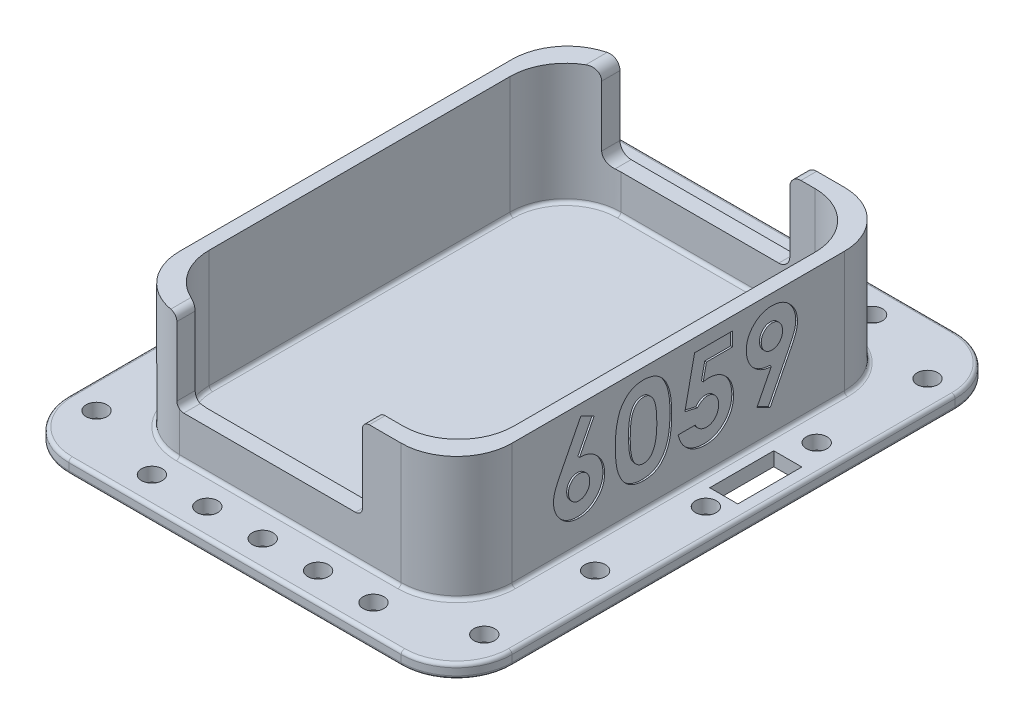
from build123d import *

# Parameters (mm, degrees)
SKETCH1_W                      = 76.2
SKETCH1_H                      = 101.6
BOSS_EXTRUDE1_DEPTH            = 0.79375
SKETCH2_W                      = 76.2
SKETCH2_H                      = 101.6
SKETCH2_W_2                    = 69.85
SKETCH2_H_2                    = 94.361
BOSS_EXTRUDE2_DEPTH            = 27.178
FILLET1_R                      = 12.7
SKETCH3_W                      = 42.545
SKETCH3_H                      = 18.44675
CUT_EXTRUDE1_DEPTH             = 113.056185898
BOSS_EXTRUDE3_START            = 0.508
BOSS_EXTRUDE3_DEPTH            = 0.508
FILLET2_R                      = 1.5875
SKETCH5_W                      = 101.6
SKETCH5_H                      = 127
BOSS_EXTRUDE4_DEPTH            = 3.175
FILLET3_R                      = 12.7
F_3_16_0_1875_DIAMETER_HOLE1_D = 4.7625
FILLET4_R                      = 0.79375
FILLET5_R                      = 0.79375
CUT_EXTRUDE2_DEPTH             = 0.396875
CUT_EXTRUDE3_DEPTH             = 0.396875
FILLET7_R                      = 0.79375
SKETCH11_W                     = 6.442740225
SKETCH11_H                     = 14.683454467
CUT_EXTRUDE4_DEPTH             = 25.4
FILLET8_R                      = 2.54


with BuildPart() as part:
    # Sketch1 → Boss-Extrude1 (new body)
    with BuildSketch(Plane(origin=(0, 0, 0), x_dir=(1, 0, 0), z_dir=(0, 1, 0))):
        Rectangle(SKETCH1_W, SKETCH1_H)
    extrude(amount=BOSS_EXTRUDE1_DEPTH)

    # Sketch2 → Boss-Extrude2 (add)
    with BuildSketch(Plane(origin=(0, 0.79375, 0), x_dir=(1, 0, 0), z_dir=(0, 1, 0))):
        Rectangle(SKETCH2_W, SKETCH2_H)
        Rectangle(SKETCH2_W_2, SKETCH2_H_2, mode=Mode.SUBTRACT)
    extrude(amount=BOSS_EXTRUDE2_DEPTH)

    # Fillet1
    fillet1_edges = [part.edges().sort_by_distance(p)[0] for p in [
        (38.1, 13.985875, 50.8),
        (-38.1, 13.985875, 50.8),
        (-38.1, 13.985875, -50.8),
        (38.1, 13.985875, -50.8),
        (34.925, 14.38275, 47.1805),
        (-34.925, 14.38275, 47.1805),
        (34.925, 14.38275, -47.1805),
        (-34.925, 14.38275, -47.1805),
    ]]
    fillet(fillet1_edges, radius=FILLET1_R)

    # Sketch3 → Cut-Extrude1 (cut, through all)
    with BuildSketch(Plane.XY.offset(50.8)):
        with Locations((-4.7625, 18.748375)):
            Rectangle(SKETCH3_W, SKETCH3_H)
    extrude(amount=-CUT_EXTRUDE1_DEPTH, mode=Mode.SUBTRACT)

    # Sketch4 → Boss-Extrude3 (add)
    with BuildSketch(Plane(origin=(0, 27.97175, 0), x_dir=(1, 0, 0), z_dir=(0, 1, 0)).offset(BOSS_EXTRUDE3_START)):
        with BuildLine():
            Line((16.51, -47.1805), (16.51, -50.8))
            Line((16.51, -50.8), (25.4, -50.8))
            ThreePointArc((25.4, -50.8), (34.380256121, -47.080256121), (38.1, -38.1))
            Line((38.1, -38.1), (38.1, 38.1))
            ThreePointArc((38.1, 38.1), (34.380256121, 47.080256121), (25.4, 50.8))
            Line((25.4, 50.8), (16.51, 50.8))
            Line((16.51, 50.8), (16.51, 47.1805))
            Line((16.51, 47.1805), (22.225, 47.1805))
            ThreePointArc((22.225, 47.1805), (31.205256121, 43.460756121), (34.925, 34.4805))
            Line((34.925, 34.4805), (34.925, -34.4805))
            ThreePointArc((34.925, -34.4805), (31.205256121, -43.460756121), (22.225, -47.1805))
            Line((22.225, -47.1805), (16.51, -47.1805))
        make_face()
        with BuildLine():
            ThreePointArc((-38.1, -38.1), (-34.602024234, -46.852870958), (-26.035, -50.784115066))
            Line((-26.035, -50.784115066), (-26.035, -46.595527858))
            ThreePointArc((-26.035, -46.595527858), (-32.46406734, -41.993921325), (-34.925, -34.4805))
            Line((-34.925, -34.4805), (-34.925, 34.4805))
            ThreePointArc((-34.925, 34.4805), (-32.46406734, 41.993921325), (-26.035, 46.595527858))
            Line((-26.035, 46.595527858), (-26.035, 50.784115066))
            ThreePointArc((-26.035, 50.784115066), (-34.602024234, 46.852870958), (-38.1, 38.1))
            Line((-38.1, 38.1), (-38.1, -38.1))
        make_face()
    extrude(amount=-BOSS_EXTRUDE3_DEPTH)

    # Fillet2
    fillet2_edges = [part.edges().sort_by_distance(p)[0] for p in [
        (16.51, 28.47975, 48.99025),
        (16.51, 9.525, 48.99025),
        (-26.035, 9.525, 48.689821462),
        (-26.035, 28.47975, 48.689821462),
    ]]
    fillet(fillet2_edges, radius=FILLET2_R)

    # Sketch5 → Boss-Extrude4 (add)
    with BuildSketch(Plane.XZ):
        Rectangle(SKETCH5_W, SKETCH5_H)
    extrude(amount=BOSS_EXTRUDE4_DEPTH)

    # Fillet3
    fillet3_edges = [part.edges().sort_by_distance(p)[0] for p in [
        (-50.8, -1.5875, -63.5),
        (50.8, -1.5875, -63.5),
        (50.8, -1.5875, 63.5),
        (-50.8, -1.5875, 63.5),
    ]]
    fillet(fillet3_edges, radius=FILLET3_R)

    # 3/16 (0.1875) Diameter Hole1 (through all)
    with Locations(Plane(origin=(-44.45, 0, 50.8), x_dir=(0, 0, 1), z_dir=(0, 1, 0))):
        with Locations((0, 0), (-25.4, 0), (-50.8, 0), (-76.2, 0), (-101.6, 0), (6.35, 19.05), (6.35, 31.75), (6.35, 44.45), (6.35, 57.15), (6.35, 69.85), (0, 88.9), (-25.4, 88.9), (-50.8, 88.9), (-76.2, 88.9), (-101.6, 88.9), (-107.95, 69.85), (-107.95, 57.15), (-107.95, 44.45), (-107.95, 31.75), (-107.95, 19.05)):
            Hole(F_3_16_0_1875_DIAMETER_HOLE1_D / 2)

    # Fillet4
    fillet4_edges = [part.edges().sort_by_distance(p)[0] for p in [
        (-34.380256121, 0, -47.080256121),
        (0, 0, -50.8),
        (34.380256121, 0, -47.080256121),
        (38.1, 0, 0),
        (34.380256121, 0, 47.080256121),
        (0, 0, 50.8),
        (-34.380256121, 0, 47.080256121),
        (-38.1, 0, 0),
    ]]
    fillet(fillet4_edges, radius=FILLET4_R)

    # Fillet5
    fillet5_edges = [part.edges().sort_by_distance(p)[0] for p in [
        (47.080256121, -3.175, 59.780256121),
        (50.8, -3.175, 0),
        (47.080256121, -3.175, -59.780256121),
        (0, -3.175, -63.5),
        (-47.080256121, -3.175, -59.780256121),
        (-50.8, -3.175, 0),
        (-47.080256121, -3.175, 59.780256121),
        (47.080256121, 0, 59.780256121),
        (50.8, 0, 0),
        (47.080256121, 0, -59.780256121),
        (0, 0, -63.5),
        (-47.080256121, 0, -59.780256121),
        (-50.8, 0, 0),
        (-47.080256121, 0, 59.780256121),
        (0, -3.175, 63.5),
        (0, 0, 63.5),
    ]]
    fillet(fillet5_edges, radius=FILLET5_R)

    # Sketch9 → Cut-Extrude2 (cut)
    # profile 1 of 4: a face of its own
    with BuildSketch(Plane.ZY.offset(38.1)):
        with BuildLine():
            Line((-21.67815406, 26.514268643), (-18.651982185, 24.980194124))
            Line((-18.651982185, 24.980194124), (-21.971994204, 18.454653258))
            add(Edge.make_bspline(
                [(-21.971994204, 18.454653258), (-21.775851009, 18.449575012), (-21.389514821, 18.439572574), (-20.821099511, 18.358731191), (-20.277683894, 18.218975825), (-19.753788733, 18.033730465), (-19.255818152, 17.784944107), (-18.775752056, 17.488999756), (-18.326009998, 17.128063787), (-17.896279778, 16.728165883), (-17.505528296, 16.285136477), (-17.166091552, 15.809087307), (-16.870278422, 15.311600707), (-16.640325199, 14.781546695), (-16.454837273, 14.22771152), (-16.320999571, 13.647881262), (-16.244641417, 13.040376863), (-16.234114172, 12.627671605), (-16.228755021, 12.417573932)],
                knots=[0, 0, 0, 0, 1.013260694, 1.995783107, 2.958651975, 3.908806537, 4.861209129, 5.829647963, 6.817170299, 7.835534541, 8.860094905, 9.863329007, 10.853101798, 11.844815043, 12.84250023, 13.867713965, 14.914507806, 16, 16, 16, 16], degree=3))
            add(Edge.make_bspline(
                [(-16.228755021, 12.417573932), (-16.233776989, 12.215052519), (-16.243703266, 11.81475453), (-16.325757085, 11.226818591), (-16.458360367, 10.662728441), (-16.647877085, 10.123610637), (-16.888768161, 9.606829956), (-17.183361629, 9.11268965), (-17.534100571, 8.644882268), (-17.931922863, 8.205893512), (-18.366811257, 7.805752016), (-18.82520731, 7.450082966), (-19.310995415, 7.156286837), (-19.814993607, 6.908169119), (-20.346480801, 6.723019551), (-20.897503265, 6.583263701), (-21.472239563, 6.502618509), (-21.862355836, 6.492477285), (-22.059764637, 6.487345566)],
                knots=[0, 0, 0, 0, 1.049934834, 2.075270938, 3.072134561, 4.05064612, 5.033440221, 6.024524368, 7.028587226, 8.060776465, 9.092543989, 10.090062252, 11.064205434, 12.031961459, 12.998029633, 13.977230324, 14.976426867, 16, 16, 16, 16], degree=3))
            add(Edge.make_bspline(
                [(-22.059764637, 6.487345566), (-22.266194253, 6.491556895), (-22.672110161, 6.499837904), (-23.266066723, 6.592563379), (-23.835722186, 6.732148656), (-24.377874992, 6.931452715), (-24.895896629, 7.185228629), (-25.383688327, 7.499250799), (-25.845359054, 7.8700564), (-26.275986725, 8.289302893), (-26.663950165, 8.748530063), (-27.009981128, 9.225327428), (-27.30272377, 9.720443189), (-27.539692114, 10.233347973), (-27.724580312, 10.762407385), (-27.853224789, 11.308625538), (-27.937048537, 11.870553587), (-27.94687496, 12.25190976), (-27.951831945, 12.444286672)],
                knots=[0, 0, 0, 0, 1.063775006, 2.091769615, 3.092589432, 4.084662827, 5.064601646, 6.061867366, 7.070035304, 8.113879863, 9.156342271, 10.166834137, 11.149076039, 12.117706134, 13.076241869, 14.034148791, 15.008317125, 16, 16, 16, 16], degree=3))
            add(Edge.make_bspline(
                [(-27.951831945, 12.444286672), (-27.949212771, 12.593260086), (-27.943959845, 12.892036161), (-27.891171076, 13.339437097), (-27.810913605, 13.788012419), (-27.717884687, 14.166534479), (-27.622092907, 14.486614495), (-27.525677744, 14.757489563), (-27.406192394, 15.058101659), (-27.269602939, 15.389218425), (-27.111614139, 15.750441528), (-26.933051298, 16.140786368), (-26.733469876, 16.563208929), (-26.591140833, 16.853347819), (-26.516976175, 17.004533066)],
                knots=[0, 0, 0, 0, 1.110454016, 2.227089276, 3.35462975, 4.507227546, 5.131400587, 5.845402449, 6.650387134, 7.543487832, 8.516250726, 9.590168902, 10.744287919, 12, 12, 12, 12], degree=3))
            Line((-26.516976175, 17.004533066), (-21.67815406, 26.514268643))
        make_face()
        with BuildLine():
            add(Edge.make_bspline(
                [(-22.136086752, 15.279653258), (-22.300151851, 15.272127939), (-22.621205714, 15.257401877), (-23.077696292, 15.103183383), (-23.493912129, 14.86125295), (-23.854693164, 14.524318033), (-24.156453303, 14.121667577), (-24.37819724, 13.662390949), (-24.511588543, 13.152617068), (-24.525447045, 12.79619167), (-24.532601175, 12.612195326)],
                knots=[0, 0, 0, 0, 0.981744412, 1.921144944, 2.858899012, 3.85339082, 4.86292663, 5.863643845, 6.897155691, 8, 8, 8, 8], degree=3))
            add(Edge.make_bspline(
                [(-24.532601175, 12.612195326), (-24.524130461, 12.42813771), (-24.507654356, 12.070133345), (-24.369247366, 11.555505507), (-24.142632178, 11.085799239), (-23.824818827, 10.67781279), (-23.451710521, 10.33915245), (-23.037977664, 10.088696935), (-22.590521469, 9.934833894), (-22.281005091, 9.916060561), (-22.124638435, 9.906576335)],
                knots=[0, 0, 0, 0, 1.098279937, 2.136227893, 3.159405121, 4.194678092, 5.206500211, 6.154139736, 7.067477469, 8, 8, 8, 8], degree=3))
            add(Edge.make_bspline(
                [(-22.124638435, 9.906576335), (-21.959497573, 9.916229482), (-21.635627661, 9.935160979), (-21.168424071, 10.082549745), (-20.741630789, 10.328809309), (-20.364262972, 10.666385399), (-20.040111188, 11.069716174), (-19.815830896, 11.542181431), (-19.671025289, 12.060523669), (-19.655837812, 12.4241818), (-19.647985791, 12.612195326)],
                knots=[0, 0, 0, 0, 0.96921794, 1.900804717, 2.848419905, 3.844199796, 4.861108892, 5.867439427, 6.897452859, 8, 8, 8, 8], degree=3))
            add(Edge.make_bspline(
                [(-19.647985791, 12.612195326), (-19.656930677, 12.796084237), (-19.674253493, 13.152206585), (-19.804368371, 13.664368639), (-20.0366797, 14.121875045), (-20.345267406, 14.525980111), (-20.718464609, 14.862764787), (-21.151338252, 15.105091322), (-21.628682081, 15.257128652), (-21.964485864, 15.272035586), (-22.136086752, 15.279653258)],
                knots=[0, 0, 0, 0, 1.083229974, 2.097801324, 3.086792542, 4.086858909, 5.079819718, 6.026392613, 6.991456328, 8, 8, 8, 8], degree=3))
        make_face(mode=Mode.SUBTRACT)
    # profile 2 of 4: a face of its own
    with BuildSketch(Plane.ZY.offset(38.1)):
        with BuildLine():
            add(Edge.make_bspline(
                [(-7.371573531, 26.514268643), (-7.20606857, 26.511811675), (-6.880641598, 26.50698062), (-6.401348924, 26.454656358), (-5.939657563, 26.375608991), (-5.493761321, 26.265365478), (-5.066869805, 26.119462115), (-4.655876008, 25.944818291), (-4.265671948, 25.732273577), (-3.891281276, 25.492193407), (-3.532848207, 25.22038862), (-3.198987429, 24.910517128), (-2.883601935, 24.569709088), (-2.59351866, 24.192812094), (-2.322313621, 23.783254422), (-2.070877952, 23.340971131), (-1.841136456, 22.86379754), (-1.630514278, 22.350872552), (-1.442175262, 21.794507641), (-1.283537542, 21.188321061), (-1.147479152, 20.53217438), (-1.032636271, 19.824434349), (-0.945833615, 19.064160211), (-0.887326877, 18.251857056), (-0.847176784, 17.389090884), (-0.843900014, 16.797240379), (-0.84221656, 16.493174893)],
                knots=[0, 0, 0, 0, 0.879237366, 1.728815576, 2.559023295, 3.367336655, 4.166867292, 4.954216142, 5.737608147, 6.525189134, 7.316157332, 8.124696809, 8.942788509, 9.781158001, 10.649253743, 11.551476218, 12.482711956, 13.461909668, 14.496590415, 15.601789533, 16.789733467, 18.056700938, 19.410929216, 20.8549011, 22.384193279, 24, 24, 24, 24], degree=3))
            add(Edge.make_bspline(
                [(-0.84221656, 16.493174893), (-0.844035918, 16.185305206), (-0.847570899, 15.587119928), (-0.885657826, 14.716462458), (-0.951245313, 13.898261494), (-1.035779201, 13.132601685), (-1.151567503, 12.419887362), (-1.2871717, 11.758273076), (-1.448313468, 11.147998645), (-1.642856311, 10.590439148), (-1.852203588, 10.07661335), (-2.082573526, 9.600370134), (-2.329950809, 9.160419569), (-2.588661349, 8.750124403), (-2.872888608, 8.381579928), (-3.168798445, 8.042253705), (-3.489275303, 7.745071106), (-3.820825866, 7.474716672), (-4.175596174, 7.241076187), (-4.549927572, 7.03673807), (-4.950493741, 6.870995589), (-5.369993039, 6.726841631), (-5.815575919, 6.623354643), (-6.280162128, 6.541241119), (-6.768996751, 6.495860149), (-7.101815052, 6.490230341), (-7.272354781, 6.487345566)],
                knots=[0, 0, 0, 0, 1.643780988, 3.193836972, 4.651895693, 6.025988579, 7.305620092, 8.505800249, 9.631074763, 10.672816429, 11.65661981, 12.592235626, 13.49536222, 14.350718032, 15.179365177, 15.97804903, 16.751647189, 17.51006938, 18.259804725, 19.016521909, 19.783502495, 20.571750527, 21.382245291, 22.22305063, 23.089471752, 24, 24, 24, 24], degree=3))
            add(Edge.make_bspline(
                [(-7.272354781, 6.487345566), (-7.442889907, 6.490285987), (-7.776965711, 6.496046227), (-8.267122192, 6.540903692), (-8.734170475, 6.623687286), (-9.183278631, 6.727636127), (-9.611320938, 6.870676634), (-10.020349846, 7.041378012), (-10.407220277, 7.24444116), (-10.773003415, 7.478626006), (-11.116450371, 7.747171564), (-11.442898309, 8.047205437), (-11.751625108, 8.377967119), (-12.037934266, 8.743161412), (-12.306514701, 9.137913735), (-12.554565542, 9.566731968), (-12.781937718, 10.028991761), (-12.995743472, 10.525337456), (-13.181513608, 11.066454808), (-13.346840404, 11.657175926), (-13.482271766, 12.302424957), (-13.59119473, 13.001994609), (-13.678158762, 13.754402812), (-13.742850006, 14.560012733), (-13.781148489, 15.419199604), (-13.784646398, 16.009761539), (-13.786447329, 16.313817922)],
                knots=[0, 0, 0, 0, 0.917216111, 1.796812873, 2.643793957, 3.46689424, 4.273913431, 5.068098542, 5.848489301, 6.620921603, 7.401012384, 8.190319798, 9.003608147, 9.831726257, 10.68377682, 11.569763213, 12.493818149, 13.453288342, 14.474581811, 15.568529029, 16.750744269, 18.018426408, 19.375425659, 20.823733699, 22.36466933, 24, 24, 24, 24], degree=3))
            add(Edge.make_bspline(
                [(-13.786447329, 16.313817922), (-13.78318511, 16.73628033), (-13.776890616, 17.551426989), (-13.697122168, 18.729076907), (-13.580042319, 19.817610258), (-13.408079753, 20.815206193), (-13.195450419, 21.725559517), (-12.923167485, 22.542673299), (-12.613193171, 23.27785414), (-12.349055233, 23.713379697), (-12.221843964, 23.923132826)],
                knots=[0, 0, 0, 0, 1.288568992, 2.486310467, 3.599230591, 4.627010532, 5.572937695, 6.447898582, 7.252493626, 8, 8, 8, 8], degree=3))
            add(Edge.make_bspline(
                [(-12.221843964, 23.923132826), (-12.073928759, 24.129194234), (-11.784725386, 24.532084893), (-11.279045206, 25.061005017), (-10.73575769, 25.513363407), (-10.143704024, 25.878922788), (-9.512247783, 26.167202945), (-8.835967593, 26.370811974), (-8.117360844, 26.489444081), (-7.623881603, 26.50587022), (-7.371573531, 26.514268643)],
                knots=[0, 0, 0, 0, 1.058512271, 2.069600068, 3.047294572, 4.004278952, 4.967380941, 5.939006123, 6.946246673, 8, 8, 8, 8], degree=3))
        make_face()
        with BuildLine():
            add(Edge.make_bspline(
                [(-7.287619204, 23.095037874), (-7.437237061, 23.087946285), (-7.730567483, 23.074043006), (-8.1562039, 22.956023785), (-8.557552467, 22.773736734), (-8.862847602, 22.554382769), (-9.091357974, 22.344105688), (-9.25101981, 22.153811768), (-9.404988486, 21.941457469), (-9.540981374, 21.697460331), (-9.66939416, 21.430587462), (-9.794892158, 21.139627417), (-9.897767563, 20.817433588), (-9.99883992, 20.469492979), (-10.087388736, 20.086185955), (-10.161573232, 19.664379405), (-10.227850558, 19.201330282), (-10.274079783, 18.696735287), (-10.317179294, 18.151122352), (-10.348075065, 17.563276063), (-10.360991811, 16.933355009), (-10.365097651, 16.499537726), (-10.36721656, 16.275656864)],
                knots=[0, 0, 0, 0, 1.076674018, 2.110852608, 3.161083442, 4.239746716, 4.804137807, 5.395870207, 6.026861976, 6.692161227, 7.405688833, 8.16177676, 8.973626916, 9.841385931, 10.773283133, 11.807421078, 12.927755683, 14.143907515, 15.458935494, 16.872852025, 18.386167141, 20, 20, 20, 20], degree=3))
            add(Edge.make_bspline(
                [(-10.36721656, 16.275656864), (-10.363729094, 15.985608384), (-10.357041618, 15.429418919), (-10.322015749, 14.629599101), (-10.2518093, 13.901698664), (-10.164486653, 13.240784356), (-10.041838429, 12.651142384), (-9.900723708, 12.127194187), (-9.726459575, 11.675618833), (-9.525063792, 11.289885528), (-9.302008888, 10.961743006), (-9.059872977, 10.682820384), (-8.806899919, 10.441286553), (-8.535193604, 10.245091599), (-8.24540224, 10.09473683), (-7.939945054, 9.986588501), (-7.61862793, 9.920386406), (-7.398593276, 9.911206303), (-7.287619204, 9.906576335)],
                knots=[0, 0, 0, 0, 1.771748488, 3.397459088, 4.888034009, 6.237357457, 7.467047327, 8.564189669, 9.548206622, 10.417051504, 11.216568818, 11.965764335, 12.669334354, 13.348544111, 14.005342236, 14.656555988, 15.322436492, 16, 16, 16, 16], degree=3))
            add(Edge.make_bspline(
                [(-7.287619204, 9.906576335), (-7.180453411, 9.909744503), (-6.970636113, 9.915947382), (-6.664675502, 9.979619099), (-6.375337408, 10.083135482), (-6.103495433, 10.229566673), (-5.848177236, 10.415776336), (-5.610630654, 10.642582757), (-5.392647217, 10.912246667), (-5.265649076, 11.112377169), (-5.200209348, 11.215500614)],
                knots=[0, 0, 0, 0, 0.992283464, 1.942767638, 2.88273346, 3.832339453, 4.79467288, 5.803907806, 6.868395428, 8, 8, 8, 8], degree=3))
            add(Edge.make_bspline(
                [(-5.200209348, 11.215500614), (-5.12316509, 11.356415506), (-4.961609528, 11.651902605), (-4.774657152, 12.150526068), (-4.617291062, 12.712890922), (-4.48184837, 13.340747302), (-4.389213831, 14.03657155), (-4.309437079, 14.795951384), (-4.270958769, 15.622710733), (-4.264700062, 16.195492593), (-4.261447329, 16.493174893)],
                knots=[0, 0, 0, 0, 0.710965849, 1.490837728, 2.352621235, 3.297892224, 4.334225155, 5.461620853, 6.680770821, 8, 8, 8, 8], degree=3))
            add(Edge.make_bspline(
                [(-4.261447329, 16.493174893), (-4.26270379, 16.793441219), (-4.265122261, 17.371402639), (-4.309494212, 18.201134246), (-4.371285544, 18.958956364), (-4.461668425, 19.643177082), (-4.577962429, 20.25545739), (-4.721295227, 20.795757262), (-4.890273935, 21.265141525), (-5.090662544, 21.663142139), (-5.312605379, 22.001388063), (-5.548204474, 22.29157683), (-5.798456037, 22.539332678), (-6.062941567, 22.745587956), (-6.347782673, 22.903182457), (-6.647538519, 23.014457212), (-6.962823627, 23.081774707), (-7.177892706, 23.090557145), (-7.287619204, 23.095037874)],
                knots=[0, 0, 0, 0, 1.793836731, 3.452829483, 4.963243077, 6.335886805, 7.574563692, 8.684454726, 9.672768357, 10.54971625, 11.340229787, 12.085688095, 12.778991901, 13.440269426, 14.083255152, 14.715733572, 15.344777694, 16, 16, 16, 16], degree=3))
        make_face(mode=Mode.SUBTRACT)
    # profile 3 of 4: a face of its own
    with BuildSketch(Plane.ZY.offset(38.1)):
        with BuildLine():
            Line((4.404928873, 26.025807105), (13.078937286, 26.025807105))
            Line((13.078937286, 26.025807105), (13.078937286, 22.850807105))
            Line((13.078937286, 22.850807105), (7.114363969, 22.850807105))
            Line((7.114363969, 22.850807105), (6.370223344, 19.248403258))
            add(Edge.make_bspline(
                [(6.370223344, 19.248403258), (6.471623156, 19.276644386), (6.67160442, 19.332341693), (6.972876441, 19.388199044), (7.264851015, 19.424404004), (7.456442949, 19.429233263), (7.549400027, 19.431576335)],
                knots=[0, 0, 0, 0, 1.05461699, 2.079921384, 3.068411212, 4, 4, 4, 4], degree=3))
            add(Edge.make_bspline(
                [(7.549400027, 19.431576335), (7.751963237, 19.426934717), (8.151259947, 19.417785064), (8.735380365, 19.330925016), (9.294710172, 19.194123071), (9.827537757, 18.999015274), (10.333342618, 18.745077436), (10.812737891, 18.437883836), (11.266311953, 18.076894931), (11.686007419, 17.661884711), (12.071641145, 17.206194092), (12.406927675, 16.713316471), (12.693283295, 16.190279802), (12.921040655, 15.633832902), (13.10080618, 15.047470631), (13.230708763, 14.430817229), (13.30752665, 13.783141872), (13.317885071, 13.341279282), (13.323168055, 13.115921287)],
                knots=[0, 0, 0, 0, 1.01440847, 1.999622559, 2.951875003, 3.895578053, 4.836219714, 5.782137149, 6.743708247, 7.735272588, 8.734977101, 9.730283169, 10.717124674, 11.717316708, 12.737475749, 13.78628267, 14.87096371, 16, 16, 16, 16], degree=3))
            add(Edge.make_bspline(
                [(13.323168055, 13.115921287), (13.316712164, 12.888004957), (13.303972803, 12.438259415), (13.220860147, 11.776974382), (13.074164816, 11.143612607), (12.872664101, 10.536478596), (12.607199808, 9.96003464), (12.287942663, 9.408309208), (11.90949489, 8.885397582), (11.475570357, 8.396660242), (11.00383747, 7.94994493), (10.501553301, 7.556968615), (9.972246549, 7.226282229), (9.415904442, 6.959031722), (8.83571889, 6.747587879), (8.231513802, 6.593666854), (7.600352818, 6.505401698), (7.171876518, 6.493430415), (6.954087527, 6.487345566)],
                knots=[0, 0, 0, 0, 1.06808661, 2.107647099, 3.116961351, 4.110378221, 5.100014249, 6.085620622, 7.093190682, 8.119403071, 9.144090782, 10.133780668, 11.103064255, 12.062861538, 13.020824475, 13.992378307, 14.979551724, 16, 16, 16, 16], degree=3))
            add(Edge.make_bspline(
                [(6.954087527, 6.487345566), (6.759325315, 6.492323352), (6.375213475, 6.502140586), (5.809433598, 6.562482481), (5.263958967, 6.669167517), (4.741685459, 6.823568389), (4.237117881, 7.013600614), (3.756089179, 7.251271824), (3.295956018, 7.532056438), (2.858025001, 7.850830132), (2.449411887, 8.209916334), (2.076473133, 8.602998051), (1.736950922, 9.02512068), (1.438110497, 9.481491931), (1.180888632, 9.971437541), (0.952779035, 10.489183389), (0.766069045, 11.040136392), (0.671319103, 11.422087625), (0.623168055, 11.61619172)],
                knots=[0, 0, 0, 0, 1.054957082, 2.080596141, 3.077793124, 4.061112343, 5.027190972, 5.994718051, 6.962465889, 7.943658696, 8.924948258, 9.904494768, 10.875059, 11.855380583, 12.854004648, 13.869083016, 14.917087635, 16, 16, 16, 16], degree=3))
            Line((0.623168055, 11.61619172), (4.530860363, 11.61619172))
            add(Edge.make_bspline(
                [(4.530860363, 11.61619172), (4.602293073, 11.481685486), (4.741114392, 11.220287971), (5.005183232, 10.873243493), (5.300791534, 10.577298872), (5.625272749, 10.329562664), (5.980729315, 10.143962913), (6.352677047, 10.003212648), (6.745788568, 9.921878283), (7.01351487, 9.911710681), (7.148708921, 9.906576335)],
                knots=[0, 0, 0, 0, 1.104910296, 2.147267069, 3.153527244, 4.136738762, 5.099945312, 6.05603338, 7.018353, 8, 8, 8, 8], degree=3))
            add(Edge.make_bspline(
                [(7.148708921, 9.906576335), (7.24293736, 9.910121646), (7.428333403, 9.917097103), (7.701485155, 9.953999025), (7.962220503, 10.023890428), (8.212477951, 10.120673773), (8.452929756, 10.241373536), (8.680128957, 10.393749123), (8.89802841, 10.569139073), (9.103310803, 10.770399634), (9.289237481, 10.994758345), (9.45227484, 11.235847075), (9.598052722, 11.48830878), (9.706032628, 11.762144102), (9.79445904, 12.049176221), (9.859579827, 12.351570308), (9.898496842, 12.669679536), (9.902099516, 12.886843787), (9.903937286, 12.997622008)],
                knots=[0, 0, 0, 0, 0.978869489, 1.925942215, 2.855067702, 3.774946051, 4.70828698, 5.642468714, 6.60995405, 7.609372294, 8.622401667, 9.629904756, 10.629323, 11.642352373, 12.678539694, 13.745912462, 14.850161547, 16, 16, 16, 16], degree=3))
            add(Edge.make_bspline(
                [(9.903937286, 12.997622008), (9.901804342, 13.105828816), (9.897652514, 13.316455993), (9.863307766, 13.625732135), (9.801865672, 13.919179221), (9.718150292, 14.199044839), (9.610984612, 14.463629508), (9.480020986, 14.714508164), (9.324699927, 14.950412707), (9.144187546, 15.166540352), (8.951691001, 15.364778774), (8.744887858, 15.538156519), (8.525641301, 15.682048009), (8.300764149, 15.807669467), (8.061280114, 15.899094025), (7.812574231, 15.962054746), (7.554908047, 16.00825279), (7.379159534, 16.010967094), (7.289904834, 16.012345566)],
                knots=[0, 0, 0, 0, 1.166249705, 2.270133367, 3.348514167, 4.393962215, 5.415026464, 6.420877785, 7.440098956, 8.453121383, 9.451844239, 10.415694839, 11.355045125, 12.27538808, 13.187007209, 14.108269027, 15.039275622, 16, 16, 16, 16], degree=3))
            add(Edge.make_bspline(
                [(7.289904834, 16.012345566), (7.192953486, 16.008666801), (6.998642185, 16.001293766), (6.709944224, 15.941301355), (6.424727158, 15.844211129), (6.141404887, 15.710259774), (5.862789876, 15.534959717), (5.581529336, 15.329352848), (5.307037662, 15.078499878), (5.13250822, 14.891664016), (5.042218536, 14.795007826)],
                knots=[0, 0, 0, 0, 0.88288272, 1.769486374, 2.674910571, 3.623812639, 4.617874466, 5.670434592, 6.794841017, 8, 8, 8, 8], degree=3))
            Line((5.042218536, 14.795007826), (2.164874786, 15.455194124))
            Line((2.164874786, 15.455194124), (4.404928873, 26.025807105))
        make_face()
    # profile 4 of 4: a face of its own
    with BuildSketch(Plane.ZY.offset(38.1)):
        with BuildLine():
            Line((21.703336325, 6.487345566), (18.673348344, 8.013787874))
            Line((18.673348344, 8.013787874), (21.993360363, 14.546960951))
            add(Edge.make_bspline(
                [(21.993360363, 14.546960951), (21.797206432, 14.551960654), (21.412108806, 14.56177628), (20.845082594, 14.643344048), (20.302849079, 14.782585434), (19.779017115, 14.967950796), (19.28083113, 15.216452271), (18.802250223, 15.513025741), (18.34989957, 15.869354502), (17.92165829, 16.269882763), (17.530660314, 16.712596139), (17.191282342, 17.188726881), (16.895475403, 17.686196949), (16.665439703, 18.216237089), (16.480673857, 18.768968669), (16.345674614, 19.34725269), (16.26991661, 19.953626289), (16.259327785, 20.366317529), (16.253937286, 20.576408066)],
                knots=[0, 0, 0, 0, 1.014336294, 1.991387562, 2.955278539, 3.906441712, 4.859855302, 5.829322156, 6.813833455, 7.833278715, 8.858926674, 9.863225732, 10.85404919, 11.846815163, 12.845559416, 13.865450493, 14.913355531, 16, 16, 16, 16], degree=3))
            add(Edge.make_bspline(
                [(16.253937286, 20.576408066), (16.258937268, 20.780193817), (16.268789629, 21.181749424), (16.350614437, 21.771102376), (16.485276894, 22.336967312), (16.67002896, 22.8792481), (16.915980976, 23.394288047), (17.20386155, 23.890151483), (17.555782489, 24.356579528), (17.953333428, 24.795591351), (18.388431832, 25.197209654), (18.850034715, 25.550330289), (19.336043237, 25.84550521), (19.840211707, 26.093397689), (20.371653336, 26.278607529), (20.922688197, 26.41834698), (21.497421136, 26.498996615), (21.887537868, 26.509137232), (22.084946902, 26.514268643)],
                knots=[0, 0, 0, 0, 1.055538678, 2.079917126, 3.075849687, 4.065898488, 5.041806164, 6.028602842, 7.031727914, 8.062953097, 9.093756959, 10.095582084, 11.068815425, 12.035667573, 13.000833448, 13.979119574, 14.977382875, 16, 16, 16, 16], degree=3))
            add(Edge.make_bspline(
                [(22.084946902, 26.514268643), (22.291361926, 26.510019813), (22.697249142, 26.501665064), (23.291413522, 26.409473698), (23.85988595, 26.26803528), (24.404976223, 26.075933054), (24.919917274, 25.815210571), (25.409017866, 25.502732861), (25.870651094, 25.131586146), (26.299859357, 24.712468028), (26.690219476, 24.256598657), (27.03622515, 23.7794134), (27.326884606, 23.281845291), (27.564952479, 22.768334953), (27.750406155, 22.238077911), (27.877881921, 21.690322017), (27.962511692, 21.126003957), (27.972140871, 20.743354608), (27.977014209, 20.549695326)],
                knots=[0, 0, 0, 0, 1.062826075, 2.08990367, 3.089830715, 4.078784409, 5.060762809, 6.057138927, 7.064407536, 8.107320944, 9.143871033, 10.153461498, 11.140480137, 12.108246174, 13.065926856, 14.029354859, 15.002654194, 16, 16, 16, 16], degree=3))
            add(Edge.make_bspline(
                [(27.977014209, 20.549695326), (27.974354783, 20.40199599), (27.968998101, 20.104496319), (27.91632713, 19.658363314), (27.836414655, 19.210993807), (27.743659313, 18.834867009), (27.64641824, 18.517814963), (27.551791602, 18.248855101), (27.430382839, 17.950259155), (27.294817821, 17.620025704), (27.137817575, 17.259602863), (26.956126989, 16.87071359), (26.760726945, 16.447590269), (26.616697824, 16.15826431), (26.54215844, 16.00852946)],
                knots=[0, 0, 0, 0, 1.105131805, 2.225983929, 3.357782449, 4.505488967, 5.122909461, 5.839607681, 6.638776516, 7.535249922, 8.51168636, 9.581005249, 10.748097757, 12, 12, 12, 12], degree=3))
            Line((26.54215844, 16.00852946), (21.703336325, 6.487345566))
        make_face()
        with BuildLine():
            add(Edge.make_bspline(
                [(22.161269017, 17.721960951), (22.32510431, 17.731606409), (22.645201377, 17.750451451), (23.104999526, 17.896165331), (23.516495492, 18.145521352), (23.881219305, 18.476794146), (24.1826159, 18.880962109), (24.401750947, 19.341071409), (24.536731391, 19.847593688), (24.550631295, 20.200301932), (24.55778344, 20.381786672)],
                knots=[0, 0, 0, 0, 0.984774978, 1.924027336, 2.867853169, 3.859505234, 4.871392407, 5.881338128, 6.909850265, 8, 8, 8, 8], degree=3))
            add(Edge.make_bspline(
                [(24.55778344, 20.381786672), (24.549169461, 20.567046713), (24.532413215, 20.927421726), (24.396139713, 21.44610248), (24.16327571, 21.914959119), (23.846477552, 22.322524657), (23.476619835, 22.663604945), (23.063025549, 22.91275491), (22.615737624, 23.066821263), (22.30619873, 23.085567392), (22.1498207, 23.095037874)],
                knots=[0, 0, 0, 0, 1.104110315, 2.147758178, 3.172670271, 4.206310416, 5.210906102, 6.157051016, 7.068948237, 8, 8, 8, 8], degree=3))
            add(Edge.make_bspline(
                [(22.1498207, 23.095037874), (21.984537899, 23.085805376), (21.660006472, 23.067677441), (21.194497437, 22.913981067), (20.765371183, 22.669615611), (20.390624976, 22.327378054), (20.066296504, 21.925180022), (19.840133407, 21.454740783), (19.69705479, 20.939679586), (19.681273466, 20.578658306), (19.673168055, 20.393234989)],
                knots=[0, 0, 0, 0, 0.970967322, 1.90648639, 2.855811969, 3.858352357, 4.877096915, 5.878517833, 6.91039038, 8, 8, 8, 8], degree=3))
            add(Edge.make_bspline(
                [(19.673168055, 20.393234989), (19.681634658, 20.210454745), (19.698101316, 19.854966257), (19.836108654, 19.345571291), (20.06090878, 18.883027055), (20.368226588, 18.475671653), (20.746766448, 18.142766641), (21.176569316, 17.896066765), (21.656004472, 17.750056348), (21.989815725, 17.731494666), (22.161269017, 17.721960951)],
                knots=[0, 0, 0, 0, 1.075706617, 2.092137047, 3.084482865, 4.090466434, 5.0784141, 6.035155512, 6.990809768, 8, 8, 8, 8], degree=3))
        make_face(mode=Mode.SUBTRACT)
    extrude(amount=-CUT_EXTRUDE2_DEPTH, mode=Mode.SUBTRACT)

    # Sketch10 → Cut-Extrude3 (cut)
    # profile 1 of 4: a face of its own
    with BuildSketch(Plane(origin=(38.1, 0, 0), x_dir=(0, 0, -1), z_dir=(1, 0, 0))):
        with BuildLine():
            Line((-22.315118815, 25.975854359), (-19.28894694, 24.44177984))
            Line((-19.28894694, 24.44177984), (-22.608958959, 17.916238975))
            add(Edge.make_bspline(
                [(-22.608958959, 17.916238975), (-22.412815765, 17.911160728), (-22.026479576, 17.90115829), (-21.458064266, 17.820316907), (-20.914648649, 17.680561541), (-20.390753489, 17.495316182), (-19.892782907, 17.246529824), (-19.412716811, 16.950585472), (-18.962974753, 16.589649503), (-18.533244533, 16.189751599), (-18.142493051, 15.746722193), (-17.803056307, 15.270673023), (-17.507243177, 14.773186424), (-17.277289955, 14.243132412), (-17.091802028, 13.689297236), (-16.957964326, 13.109466978), (-16.881606173, 12.501962579), (-16.871078928, 12.089257321), (-16.865719777, 11.879159648)],
                knots=[0, 0, 0, 0, 1.013260694, 1.995783107, 2.958651975, 3.908806537, 4.861209129, 5.829647963, 6.817170299, 7.835534541, 8.860094905, 9.863329007, 10.853101798, 11.844815043, 12.84250023, 13.867713965, 14.914507806, 16, 16, 16, 16], degree=3))
            add(Edge.make_bspline(
                [(-16.865719777, 11.879159648), (-16.870741745, 11.676638235), (-16.880668021, 11.276340246), (-16.96272184, 10.688404308), (-17.095325123, 10.124314157), (-17.284841841, 9.585196353), (-17.525732916, 9.068415672), (-17.820326384, 8.574275367), (-18.171065326, 8.106467984), (-18.568887618, 7.667479228), (-19.003776012, 7.267337732), (-19.462172066, 6.911668683), (-19.947960171, 6.617872553), (-20.451958362, 6.369754835), (-20.983445556, 6.184605267), (-21.534468021, 6.044849418), (-22.109204318, 5.964204225), (-22.499320591, 5.954063001), (-22.696729392, 5.948931282)],
                knots=[0, 0, 0, 0, 1.049934834, 2.075270938, 3.072134561, 4.05064612, 5.033440221, 6.024524368, 7.028587226, 8.060776465, 9.092543989, 10.090062252, 11.064205434, 12.031961459, 12.998029633, 13.977230324, 14.976426867, 16, 16, 16, 16], degree=3))
            add(Edge.make_bspline(
                [(-22.696729392, 5.948931282), (-22.903159008, 5.953142611), (-23.309074916, 5.96142362), (-23.903031479, 6.054149095), (-24.472686941, 6.193734372), (-25.014839747, 6.393038431), (-25.532861385, 6.646814345), (-26.020653082, 6.960836515), (-26.482323809, 7.331642117), (-26.91295148, 7.750888609), (-27.300914921, 8.210115779), (-27.646945884, 8.686913144), (-27.939688525, 9.182028905), (-28.176656869, 9.694933689), (-28.361545067, 10.223993101), (-28.490189544, 10.770211254), (-28.574013293, 11.332139303), (-28.583839715, 11.713495476), (-28.5887967, 11.905872388)],
                knots=[0, 0, 0, 0, 1.063775006, 2.091769615, 3.092589432, 4.084662827, 5.064601646, 6.061867366, 7.070035304, 8.113879863, 9.156342271, 10.166834137, 11.149076039, 12.117706134, 13.076241869, 14.034148791, 15.008317125, 16, 16, 16, 16], degree=3))
            add(Edge.make_bspline(
                [(-28.5887967, 11.905872388), (-28.586177526, 12.054845802), (-28.5809246, 12.353621877), (-28.528135831, 12.801022813), (-28.44787836, 13.249598135), (-28.354849443, 13.628120196), (-28.259057662, 13.948200211), (-28.162642499, 14.219075279), (-28.043157149, 14.519687375), (-27.906567694, 14.850804141), (-27.748578894, 15.212027244), (-27.570016054, 15.602372084), (-27.370434631, 16.024794646), (-27.228105588, 16.314933536), (-27.153940931, 16.466118782)],
                knots=[0, 0, 0, 0, 1.110454016, 2.227089276, 3.35462975, 4.507227546, 5.131400587, 5.845402449, 6.650387134, 7.543487832, 8.516250726, 9.590168902, 10.744287919, 12, 12, 12, 12], degree=3))
            Line((-27.153940931, 16.466118782), (-22.315118815, 25.975854359))
        make_face()
        with BuildLine():
            add(Edge.make_bspline(
                [(-22.773051508, 14.741238975), (-22.937116606, 14.733713655), (-23.258170469, 14.718987593), (-23.714661048, 14.564769099), (-24.130876884, 14.322838666), (-24.491657919, 13.985903749), (-24.793418058, 13.583253293), (-25.015161996, 13.123976665), (-25.148553298, 12.614202785), (-25.1624118, 12.257777386), (-25.169565931, 12.073781042)],
                knots=[0, 0, 0, 0, 0.981744412, 1.921144944, 2.858899012, 3.85339082, 4.86292663, 5.863643845, 6.897155691, 8, 8, 8, 8], degree=3))
            add(Edge.make_bspline(
                [(-25.169565931, 12.073781042), (-25.161095216, 11.889723426), (-25.144619111, 11.531719061), (-25.006212121, 11.017091223), (-24.779596933, 10.547384956), (-24.461783582, 10.139398506), (-24.088675276, 9.800738166), (-23.67494242, 9.550282651), (-23.227486224, 9.39641961), (-22.917969846, 9.377646277), (-22.76160319, 9.368162052)],
                knots=[0, 0, 0, 0, 1.098279937, 2.136227893, 3.159405121, 4.194678092, 5.206500211, 6.154139736, 7.067477469, 8, 8, 8, 8], degree=3))
            add(Edge.make_bspline(
                [(-22.76160319, 9.368162052), (-22.596462328, 9.377815198), (-22.272592416, 9.396746695), (-21.805388827, 9.544135461), (-21.378595545, 9.790395025), (-21.001227727, 10.127971115), (-20.677075943, 10.53130189), (-20.452795651, 11.003767147), (-20.307990045, 11.522109385), (-20.292802567, 11.885767516), (-20.284950546, 12.073781042)],
                knots=[0, 0, 0, 0, 0.96921794, 1.900804717, 2.848419905, 3.844199796, 4.861108892, 5.867439427, 6.897452859, 8, 8, 8, 8], degree=3))
            add(Edge.make_bspline(
                [(-20.284950546, 12.073781042), (-20.293895432, 12.257669953), (-20.311218248, 12.613792301), (-20.441333126, 13.125954355), (-20.673644455, 13.583460761), (-20.982232161, 13.987565827), (-21.355429364, 14.324350503), (-21.788303007, 14.566677039), (-22.265646837, 14.718714368), (-22.601450619, 14.733621302), (-22.773051508, 14.741238975)],
                knots=[0, 0, 0, 0, 1.083229974, 2.097801324, 3.086792542, 4.086858909, 5.079819718, 6.026392613, 6.991456328, 8, 8, 8, 8], degree=3))
        make_face(mode=Mode.SUBTRACT)
    # profile 2 of 4: a face of its own
    with BuildSketch(Plane(origin=(38.1, 0, 0), x_dir=(0, 0, -1), z_dir=(1, 0, 0))):
        with BuildLine():
            add(Edge.make_bspline(
                [(-8.008538286, 25.975854359), (-7.843033326, 25.973397391), (-7.517606353, 25.968566336), (-7.038313679, 25.916242074), (-6.576622318, 25.837194707), (-6.130726077, 25.726951194), (-5.70383456, 25.581047831), (-5.292840764, 25.406404007), (-4.902636704, 25.193859293), (-4.528246031, 24.953779123), (-4.169812962, 24.681974336), (-3.835952184, 24.372102844), (-3.52056669, 24.031294805), (-3.230483415, 23.65439781), (-2.959278376, 23.244840139), (-2.707842707, 22.802556848), (-2.478101211, 22.325383257), (-2.267479034, 21.812458268), (-2.079140017, 21.256093357), (-1.920502297, 20.649906778), (-1.784443908, 19.993760097), (-1.669601027, 19.286020065), (-1.58279837, 18.525745927), (-1.524291632, 17.713442772), (-1.48414154, 16.8506766), (-1.480864769, 16.258826095), (-1.479181315, 15.954760609)],
                knots=[0, 0, 0, 0, 0.879237366, 1.728815576, 2.559023295, 3.367336655, 4.166867292, 4.954216142, 5.737608147, 6.525189134, 7.316157332, 8.124696809, 8.942788509, 9.781158001, 10.649253743, 11.551476218, 12.482711956, 13.461909668, 14.496590415, 15.601789533, 16.789733467, 18.056700938, 19.410929216, 20.8549011, 22.384193279, 24, 24, 24, 24], degree=3))
            add(Edge.make_bspline(
                [(-1.479181315, 15.954760609), (-1.481000674, 15.646890923), (-1.484535655, 15.048705644), (-1.522622581, 14.178048174), (-1.588210069, 13.35984721), (-1.672743956, 12.594187401), (-1.788532258, 11.881473079), (-1.924136455, 11.219858793), (-2.085278224, 10.609584362), (-2.279821067, 10.052024864), (-2.489168343, 9.538199066), (-2.719538281, 9.06195585), (-2.966915564, 8.622005285), (-3.225626104, 8.211710119), (-3.509853363, 7.843165644), (-3.8057632, 7.503839421), (-4.126240058, 7.206656822), (-4.457790622, 6.936302388), (-4.812560929, 6.702661903), (-5.186892328, 6.498323787), (-5.587458496, 6.332581305), (-6.006957795, 6.188427347), (-6.452540674, 6.084940359), (-6.917126883, 6.002826835), (-7.405961506, 5.957445865), (-7.738779807, 5.951816057), (-7.909319536, 5.948931282)],
                knots=[0, 0, 0, 0, 1.643780988, 3.193836972, 4.651895693, 6.025988579, 7.305620092, 8.505800249, 9.631074763, 10.672816429, 11.65661981, 12.592235626, 13.49536222, 14.350718032, 15.179365177, 15.97804903, 16.751647189, 17.51006938, 18.259804725, 19.016521909, 19.783502495, 20.571750527, 21.382245291, 22.22305063, 23.089471752, 24, 24, 24, 24], degree=3))
            add(Edge.make_bspline(
                [(-7.909319536, 5.948931282), (-8.079854663, 5.951871703), (-8.413930467, 5.957631943), (-8.904086947, 6.002489408), (-9.37113523, 6.085273003), (-9.820243386, 6.189221843), (-10.248285693, 6.33226235), (-10.657314601, 6.502963728), (-11.044185033, 6.706026876), (-11.40996817, 6.940211722), (-11.753415126, 7.20875728), (-12.079863064, 7.508791154), (-12.388589863, 7.839552835), (-12.674899022, 8.204747128), (-12.943479456, 8.599499452), (-13.191530297, 9.028317684), (-13.418902473, 9.490577477), (-13.632708227, 9.986923172), (-13.818478363, 10.528040524), (-13.983805159, 11.118761642), (-14.119236522, 11.764010673), (-14.228159486, 12.463580325), (-14.315123517, 13.215988528), (-14.379814762, 14.021598449), (-14.418113244, 14.88078532), (-14.421611153, 15.471347255), (-14.423412084, 15.775403638)],
                knots=[0, 0, 0, 0, 0.917216111, 1.796812873, 2.643793957, 3.46689424, 4.273913431, 5.068098542, 5.848489301, 6.620921603, 7.401012384, 8.190319798, 9.003608147, 9.831726257, 10.68377682, 11.569763213, 12.493818149, 13.453288342, 14.474581811, 15.568529029, 16.750744269, 18.018426408, 19.375425659, 20.823733699, 22.36466933, 24, 24, 24, 24], degree=3))
            add(Edge.make_bspline(
                [(-14.423412084, 15.775403638), (-14.420149865, 16.197866046), (-14.413855372, 17.013012705), (-14.334086924, 18.190662623), (-14.217007074, 19.279195974), (-14.045044508, 20.276791909), (-13.832415174, 21.187145233), (-13.56013224, 22.004259015), (-13.250157927, 22.739439856), (-12.986019989, 23.174965413), (-12.858808719, 23.384718542)],
                knots=[0, 0, 0, 0, 1.288568992, 2.486310467, 3.599230591, 4.627010532, 5.572937695, 6.447898582, 7.252493626, 8, 8, 8, 8], degree=3))
            add(Edge.make_bspline(
                [(-12.858808719, 23.384718542), (-12.710893514, 23.590779951), (-12.421690141, 23.993670609), (-11.916009961, 24.522590733), (-11.372722445, 24.974949123), (-10.780668779, 25.340508504), (-10.149212538, 25.628788661), (-9.472932348, 25.83239769), (-8.7543256, 25.951029798), (-8.260846359, 25.967455936), (-8.008538286, 25.975854359)],
                knots=[0, 0, 0, 0, 1.058512271, 2.069600068, 3.047294572, 4.004278952, 4.967380941, 5.939006123, 6.946246673, 8, 8, 8, 8], degree=3))
        make_face()
        with BuildLine():
            add(Edge.make_bspline(
                [(-7.924583959, 22.55662359), (-8.074201816, 22.549532001), (-8.367532238, 22.535628722), (-8.793168656, 22.417609501), (-9.194517222, 22.23532245), (-9.499812357, 22.015968485), (-9.728322729, 21.805691404), (-9.887984565, 21.615397485), (-10.041953241, 21.403043185), (-10.177946129, 21.159046047), (-10.306358915, 20.892173178), (-10.431856913, 20.601213133), (-10.534732318, 20.279019305), (-10.635804675, 19.931078695), (-10.724353491, 19.547771672), (-10.798537987, 19.125965121), (-10.864815313, 18.662915998), (-10.911044538, 18.158321003), (-10.954144049, 17.612708068), (-10.98503982, 17.02486178), (-10.997956566, 16.394940725), (-11.002062407, 15.961123443), (-11.004181315, 15.73724258)],
                knots=[0, 0, 0, 0, 1.076674018, 2.110852608, 3.161083442, 4.239746716, 4.804137807, 5.395870207, 6.026861976, 6.692161227, 7.405688833, 8.16177676, 8.973626916, 9.841385931, 10.773283133, 11.807421078, 12.927755683, 14.143907515, 15.458935494, 16.872852025, 18.386167141, 20, 20, 20, 20], degree=3))
            add(Edge.make_bspline(
                [(-11.004181315, 15.73724258), (-11.000693849, 15.447194101), (-10.994006374, 14.891004635), (-10.958980504, 14.091184818), (-10.888774055, 13.36328438), (-10.801451408, 12.702370072), (-10.678803184, 12.1127281), (-10.537688463, 11.588779903), (-10.36342433, 11.13720455), (-10.162028547, 10.751471244), (-9.938973643, 10.423328722), (-9.696837732, 10.1444061), (-9.443864675, 9.90287227), (-9.172158359, 9.706677315), (-8.882366996, 9.556322546), (-8.576909809, 9.448174217), (-8.255592685, 9.381972122), (-8.035558031, 9.372792019), (-7.924583959, 9.368162052)],
                knots=[0, 0, 0, 0, 1.771748488, 3.397459088, 4.888034009, 6.237357457, 7.467047327, 8.564189669, 9.548206622, 10.417051504, 11.216568818, 11.965764335, 12.669334354, 13.348544111, 14.005342236, 14.656555988, 15.322436492, 16, 16, 16, 16], degree=3))
            add(Edge.make_bspline(
                [(-7.924583959, 9.368162052), (-7.817418166, 9.371330219), (-7.607600868, 9.377533098), (-7.301640258, 9.441204815), (-7.012302164, 9.544721198), (-6.740460188, 9.691152389), (-6.485141991, 9.877362052), (-6.247595409, 10.104168473), (-6.029611972, 10.373832383), (-5.902613832, 10.573962886), (-5.837174104, 10.67708633)],
                knots=[0, 0, 0, 0, 0.992283464, 1.942767638, 2.88273346, 3.832339453, 4.79467288, 5.803907806, 6.868395428, 8, 8, 8, 8], degree=3))
            add(Edge.make_bspline(
                [(-5.837174104, 10.67708633), (-5.760129845, 10.818001222), (-5.598574283, 11.113488321), (-5.411621907, 11.612111784), (-5.254255818, 12.174476639), (-5.118813125, 12.802333018), (-5.026178586, 13.498157266), (-4.946401834, 14.2575371), (-4.907923524, 15.084296449), (-4.901664817, 15.657078309), (-4.898412084, 15.954760609)],
                knots=[0, 0, 0, 0, 0.710965849, 1.490837728, 2.352621235, 3.297892224, 4.334225155, 5.461620853, 6.680770821, 8, 8, 8, 8], degree=3))
            add(Edge.make_bspline(
                [(-4.898412084, 15.954760609), (-4.899668545, 16.255026935), (-4.902087016, 16.832988355), (-4.946458967, 17.662719962), (-5.008250299, 18.42054208), (-5.09863318, 19.104762798), (-5.214927184, 19.717043106), (-5.358259983, 20.257342978), (-5.52723869, 20.726727241), (-5.727627299, 21.124727855), (-5.949570134, 21.46297378), (-6.185169229, 21.753162546), (-6.435420792, 22.000918394), (-6.699906322, 22.207173672), (-6.984747428, 22.364768173), (-7.284503274, 22.476042928), (-7.599788382, 22.543360423), (-7.814857461, 22.552142861), (-7.924583959, 22.55662359)],
                knots=[0, 0, 0, 0, 1.793836731, 3.452829483, 4.963243077, 6.335886805, 7.574563692, 8.684454726, 9.672768357, 10.54971625, 11.340229787, 12.085688095, 12.778991901, 13.440269426, 14.083255152, 14.715733572, 15.344777694, 16, 16, 16, 16], degree=3))
        make_face(mode=Mode.SUBTRACT)
    # profile 3 of 4: a face of its own
    with BuildSketch(Plane(origin=(38.1, 0, 0), x_dir=(0, 0, -1), z_dir=(1, 0, 0))):
        with BuildLine():
            Line((3.767964117, 25.487392821), (12.441972531, 25.487392821))
            Line((12.441972531, 25.487392821), (12.441972531, 22.312392821))
            Line((12.441972531, 22.312392821), (6.477399214, 22.312392821))
            Line((6.477399214, 22.312392821), (5.733258589, 18.709988975))
            add(Edge.make_bspline(
                [(5.733258589, 18.709988975), (5.834658401, 18.738230103), (6.034639665, 18.793927409), (6.335911686, 18.84978476), (6.62788626, 18.88598972), (6.819478193, 18.890818979), (6.912435271, 18.893162052)],
                knots=[0, 0, 0, 0, 1.05461699, 2.079921384, 3.068411212, 4, 4, 4, 4], degree=3))
            add(Edge.make_bspline(
                [(6.912435271, 18.893162052), (7.114998482, 18.888520433), (7.514295192, 18.87937078), (8.09841561, 18.792510732), (8.657745417, 18.655708787), (9.190573001, 18.46060099), (9.696377862, 18.206663152), (10.175773136, 17.899469552), (10.629347197, 17.538480647), (11.049042664, 17.123470427), (11.434676389, 16.667779809), (11.769962919, 16.174902187), (12.05631854, 15.651865519), (12.2840759, 15.095418619), (12.463841425, 14.509056347), (12.593744008, 13.892402946), (12.670561895, 13.244727588), (12.680920316, 12.802864998), (12.6862033, 12.577507004)],
                knots=[0, 0, 0, 0, 1.01440847, 1.999622559, 2.951875003, 3.895578053, 4.836219714, 5.782137149, 6.743708247, 7.735272588, 8.734977101, 9.730283169, 10.717124674, 11.717316708, 12.737475749, 13.78628267, 14.87096371, 16, 16, 16, 16], degree=3))
            add(Edge.make_bspline(
                [(12.6862033, 12.577507004), (12.679747409, 12.349590674), (12.667008048, 11.899845131), (12.583895392, 11.238560098), (12.437200061, 10.605198324), (12.235699346, 9.998064312), (11.970235053, 9.421620356), (11.650977908, 8.869894924), (11.272530134, 8.346983298), (10.838605602, 7.858245958), (10.366872715, 7.411530646), (9.864588546, 7.018554331), (9.335281794, 6.687867945), (8.778939686, 6.420617438), (8.198754134, 6.209173595), (7.594549047, 6.05525257), (6.963388063, 5.966987414), (6.534911762, 5.955016131), (6.317122771, 5.948931282)],
                knots=[0, 0, 0, 0, 1.06808661, 2.107647099, 3.116961351, 4.110378221, 5.100014249, 6.085620622, 7.093190682, 8.119403071, 9.144090782, 10.133780668, 11.103064255, 12.062861538, 13.020824475, 13.992378307, 14.979551724, 16, 16, 16, 16], degree=3))
            add(Edge.make_bspline(
                [(6.317122771, 5.948931282), (6.12236056, 5.953909068), (5.73824872, 5.963726302), (5.172468842, 6.024068197), (4.626994212, 6.130753234), (4.104720704, 6.285154105), (3.600153126, 6.47518633), (3.119124423, 6.71285754), (2.658991262, 6.993642155), (2.221060246, 7.312415848), (1.812447131, 7.67150205), (1.439508378, 8.064583767), (1.099986167, 8.486706396), (0.801145741, 8.943077647), (0.543923877, 9.433023257), (0.31581428, 9.950769105), (0.12910429, 10.501722108), (0.034354347, 10.883673341), (-0.0137967, 11.077777436)],
                knots=[0, 0, 0, 0, 1.054957082, 2.080596141, 3.077793124, 4.061112343, 5.027190972, 5.994718051, 6.962465889, 7.943658696, 8.924948258, 9.904494768, 10.875059, 11.855380583, 12.854004648, 13.869083016, 14.917087635, 16, 16, 16, 16], degree=3))
            Line((-0.0137967, 11.077777436), (3.893895608, 11.077777436))
            add(Edge.make_bspline(
                [(3.893895608, 11.077777436), (3.965328318, 10.943271203), (4.104149637, 10.681873688), (4.368218477, 10.33482921), (4.663826778, 10.038884588), (4.988307994, 9.79114838), (5.343764559, 9.605548629), (5.715712291, 9.464798364), (6.108823812, 9.383464), (6.376550115, 9.373296397), (6.511744166, 9.368162052)],
                knots=[0, 0, 0, 0, 1.104910296, 2.147267069, 3.153527244, 4.136738762, 5.099945312, 6.05603338, 7.018353, 8, 8, 8, 8], degree=3))
            add(Edge.make_bspline(
                [(6.511744166, 9.368162052), (6.605972605, 9.371707362), (6.791368648, 9.378682819), (7.0645204, 9.415584741), (7.325255748, 9.485476144), (7.575513196, 9.582259489), (7.815965001, 9.702959252), (8.043164202, 9.855334839), (8.261063655, 10.030724789), (8.466346048, 10.23198535), (8.652272726, 10.456344061), (8.815310084, 10.697432792), (8.961087967, 10.949894496), (9.069067873, 11.223729818), (9.157494285, 11.510761937), (9.222615072, 11.813156024), (9.261532086, 12.131265252), (9.265134761, 12.348429504), (9.266972531, 12.459207725)],
                knots=[0, 0, 0, 0, 0.978869489, 1.925942215, 2.855067702, 3.774946051, 4.70828698, 5.642468714, 6.60995405, 7.609372294, 8.622401667, 9.629904756, 10.629323, 11.642352373, 12.678539694, 13.745912462, 14.850161547, 16, 16, 16, 16], degree=3))
            add(Edge.make_bspline(
                [(9.266972531, 12.459207725), (9.264839587, 12.567414532), (9.260687759, 12.778041709), (9.22634301, 13.087317851), (9.164900917, 13.380764937), (9.081185537, 13.660630555), (8.974019857, 13.925215224), (8.843056231, 14.17609388), (8.687735172, 14.411998423), (8.507222791, 14.628126068), (8.314726246, 14.826364491), (8.107923102, 14.999742236), (7.888676546, 15.143633725), (7.663799394, 15.269255183), (7.424315359, 15.360679741), (7.175609476, 15.423640462), (6.917943292, 15.469838506), (6.742194779, 15.47255281), (6.652940079, 15.473931282)],
                knots=[0, 0, 0, 0, 1.166249705, 2.270133367, 3.348514167, 4.393962215, 5.415026464, 6.420877785, 7.440098956, 8.453121383, 9.451844239, 10.415694839, 11.355045125, 12.27538808, 13.187007209, 14.108269027, 15.039275622, 16, 16, 16, 16], degree=3))
            add(Edge.make_bspline(
                [(6.652940079, 15.473931282), (6.555988731, 15.470252517), (6.361677429, 15.462879482), (6.072979468, 15.402887071), (5.787762403, 15.305796845), (5.504440132, 15.17184549), (5.225825121, 14.996545433), (4.94456458, 14.790938564), (4.670072907, 14.540085594), (4.495543465, 14.353249732), (4.405253781, 14.256593542)],
                knots=[0, 0, 0, 0, 0.88288272, 1.769486374, 2.674910571, 3.623812639, 4.617874466, 5.670434592, 6.794841017, 8, 8, 8, 8], degree=3))
            Line((4.405253781, 14.256593542), (1.527910031, 14.91677984))
            Line((1.527910031, 14.91677984), (3.767964117, 25.487392821))
        make_face()
    # profile 4 of 4: a face of its own
    with BuildSketch(Plane(origin=(38.1, 0, 0), x_dir=(0, 0, -1), z_dir=(1, 0, 0))):
        with BuildLine():
            Line((21.066371569, 5.948931282), (18.036383589, 7.47537359))
            Line((18.036383589, 7.47537359), (21.356395608, 14.008546667))
            add(Edge.make_bspline(
                [(21.356395608, 14.008546667), (21.160241677, 14.01354637), (20.77514405, 14.023361997), (20.208117838, 14.104929764), (19.665884324, 14.24417115), (19.142052359, 14.429536512), (18.643866375, 14.678037987), (18.165285468, 14.974611457), (17.712934815, 15.330940218), (17.284693535, 15.731468479), (16.893695559, 16.174181855), (16.554317587, 16.650312597), (16.258510648, 17.147782665), (16.028474947, 17.677822805), (15.843709102, 18.230554386), (15.708709859, 18.808838406), (15.632951854, 19.415212005), (15.62236303, 19.827903245), (15.616972531, 20.037993782)],
                knots=[0, 0, 0, 0, 1.014336294, 1.991387562, 2.955278539, 3.906441712, 4.859855302, 5.829322156, 6.813833455, 7.833278715, 8.858926674, 9.863225732, 10.85404919, 11.846815163, 12.845559416, 13.865450493, 14.913355531, 16, 16, 16, 16], degree=3))
            add(Edge.make_bspline(
                [(15.616972531, 20.037993782), (15.621972513, 20.241779534), (15.631824874, 20.64333514), (15.713649682, 21.232688092), (15.848312138, 21.798553028), (16.033064205, 22.340833816), (16.27901622, 22.855873763), (16.566896794, 23.351737199), (16.918817734, 23.818165245), (17.316368673, 24.257177067), (17.751467076, 24.65879537), (18.21306996, 25.011916005), (18.699078482, 25.307090926), (19.203246952, 25.554983405), (19.73468858, 25.740193245), (20.285723442, 25.879932696), (20.860456381, 25.960582331), (21.250573113, 25.970722948), (21.447982146, 25.975854359)],
                knots=[0, 0, 0, 0, 1.055538678, 2.079917126, 3.075849687, 4.065898488, 5.041806164, 6.028602842, 7.031727914, 8.062953097, 9.093756959, 10.095582084, 11.068815425, 12.035667573, 13.000833448, 13.979119574, 14.977382875, 16, 16, 16, 16], degree=3))
            add(Edge.make_bspline(
                [(21.447982146, 25.975854359), (21.654397171, 25.971605529), (22.060284387, 25.96325078), (22.654448766, 25.871059414), (23.222921194, 25.729620996), (23.768011467, 25.53751877), (24.282952519, 25.276796288), (24.77205311, 24.964318577), (25.233686339, 24.593171863), (25.662894602, 24.174053744), (26.053254721, 23.718184373), (26.399260395, 23.240999116), (26.689919851, 22.743431007), (26.927987724, 22.229920669), (27.113441399, 21.699663627), (27.240917166, 21.151907733), (27.325546937, 20.587589673), (27.335176115, 20.204940324), (27.340049454, 20.011281042)],
                knots=[0, 0, 0, 0, 1.062826075, 2.08990367, 3.089830715, 4.078784409, 5.060762809, 6.057138927, 7.064407536, 8.107320944, 9.143871033, 10.153461498, 11.140480137, 12.108246174, 13.065926856, 14.029354859, 15.002654194, 16, 16, 16, 16], degree=3))
            add(Edge.make_bspline(
                [(27.340049454, 20.011281042), (27.337390028, 19.863581706), (27.332033345, 19.566082035), (27.279362375, 19.11994903), (27.1994499, 18.672579523), (27.106694557, 18.296452725), (27.009453484, 17.97940068), (26.914826846, 17.710440817), (26.793418084, 17.411844871), (26.657853066, 17.081611421), (26.50085282, 16.721188579), (26.319162234, 16.332299306), (26.12376219, 15.909175985), (25.979733069, 15.619850027), (25.905193685, 15.470115177)],
                knots=[0, 0, 0, 0, 1.105131805, 2.225983929, 3.357782449, 4.505488967, 5.122909461, 5.839607681, 6.638776516, 7.535249922, 8.51168636, 9.581005249, 10.748097757, 12, 12, 12, 12], degree=3))
            Line((25.905193685, 15.470115177), (21.066371569, 5.948931282))
        make_face()
        with BuildLine():
            add(Edge.make_bspline(
                [(21.524304262, 17.183546667), (21.688139555, 17.193192125), (22.008236622, 17.212037167), (22.468034771, 17.357751047), (22.879530737, 17.607107068), (23.24425455, 17.938379863), (23.545651144, 18.342547826), (23.764786192, 18.802657125), (23.899766635, 19.309179404), (23.91366654, 19.661887648), (23.920818685, 19.843372388)],
                knots=[0, 0, 0, 0, 0.984774978, 1.924027336, 2.867853169, 3.859505234, 4.871392407, 5.881338128, 6.909850265, 8, 8, 8, 8], degree=3))
            add(Edge.make_bspline(
                [(23.920818685, 19.843372388), (23.912204706, 20.02863243), (23.89544846, 20.389007443), (23.759174958, 20.907688196), (23.526310954, 21.376544835), (23.209512797, 21.784110374), (22.83965508, 22.125190661), (22.426060794, 22.374340627), (21.978772869, 22.528406979), (21.669233975, 22.547153108), (21.512855944, 22.55662359)],
                knots=[0, 0, 0, 0, 1.104110315, 2.147758178, 3.172670271, 4.206310416, 5.210906102, 6.157051016, 7.068948237, 8, 8, 8, 8], degree=3))
            add(Edge.make_bspline(
                [(21.512855944, 22.55662359), (21.347573144, 22.547391092), (21.023041717, 22.529263157), (20.557532682, 22.375566783), (20.128406428, 22.131201327), (19.753660221, 21.78896377), (19.429331749, 21.386765739), (19.203168652, 20.916326499), (19.060090035, 20.401265302), (19.04430871, 20.040244022), (19.0362033, 19.854820705)],
                knots=[0, 0, 0, 0, 0.970967322, 1.90648639, 2.855811969, 3.858352357, 4.877096915, 5.878517833, 6.91039038, 8, 8, 8, 8], degree=3))
            add(Edge.make_bspline(
                [(19.0362033, 19.854820705), (19.044669903, 19.672040462), (19.061136561, 19.316551973), (19.199143899, 18.807157007), (19.423944024, 18.344612771), (19.731261833, 17.937257369), (20.109801693, 17.604352357), (20.539604561, 17.357652481), (21.019039717, 17.211642064), (21.35285097, 17.193080382), (21.524304262, 17.183546667)],
                knots=[0, 0, 0, 0, 1.075706617, 2.092137047, 3.084482865, 4.090466434, 5.0784141, 6.035155512, 6.990809768, 8, 8, 8, 8], degree=3))
        make_face(mode=Mode.SUBTRACT)
    extrude(amount=-CUT_EXTRUDE3_DEPTH, mode=Mode.SUBTRACT)

    # Fillet7
    fillet7_edges = [part.edges().sort_by_distance(p)[0] for p in [
        (31.205256121, 0.79375, 43.460756121),
        (0, 0.79375, 47.1805),
        (-31.205256121, 0.79375, 43.460756121),
        (-34.925, 0.79375, 0),
        (-31.205256121, 0.79375, -43.460756121),
        (0, 0.79375, -47.1805),
        (31.205256121, 0.79375, -43.460756121),
        (34.925, 0.79375, 0),
    ]]
    fillet(fillet7_edges, radius=FILLET7_R)

    # Sketch11 → Cut-Extrude4 (cut)
    with BuildSketch(Plane(origin=(0, 0, 0), x_dir=(1, 0, 0), z_dir=(0, 1, 0))):
        with Locations((-44.350025739, 11.536999939)):
            Rectangle(SKETCH11_W, SKETCH11_H)
        with Locations((44.350025739, 11.536999939)):
            Rectangle(SKETCH11_W, SKETCH11_H)
    extrude(amount=-CUT_EXTRUDE4_DEPTH, mode=Mode.SUBTRACT)

    # Fillet8
    fillet8_edges = [part.edges().sort_by_distance(p)[0] for p in [
        (16.51, 28.47975, -48.99025),
        (-26.035, 28.47975, -48.689821462),
        (-26.035, 9.525, -48.689821462),
        (16.51, 9.525, -48.99025),
    ]]
    fillet(fillet8_edges, radius=FILLET8_R)


solid = part.part
